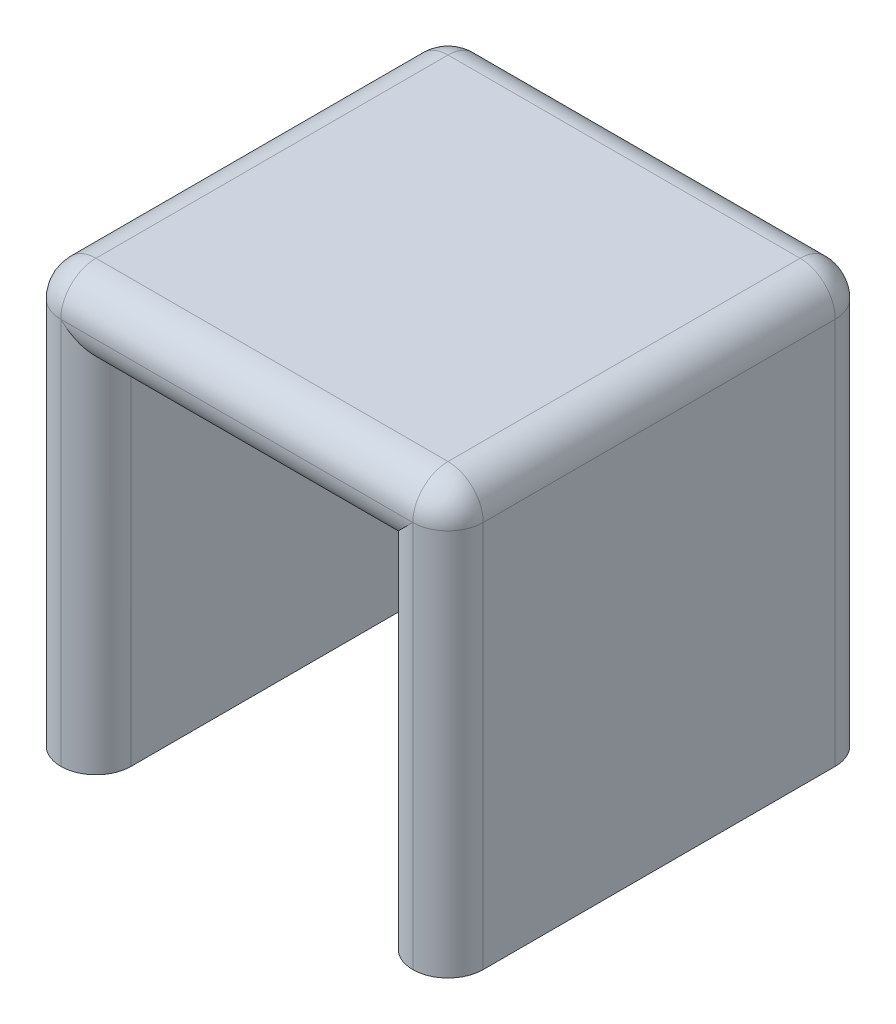
from build123d import *

# Parameters (mm, degrees)
BOSS_EXTRUDE1_DEPTH = 12
FILLET3_R           = 1


with BuildPart() as part:
    # Sketch1 → Boss-Extrude1 (new body)
    with BuildSketch(Plane.XY):
        Polygon((0, 0), (0, 12), (12, 12), (12, 0), (10, 0), (10, 10), (2, 10), (2, 0), align=None)
    extrude(amount=BOSS_EXTRUDE1_DEPTH)

    # Fillet3
    fillet3_edges = [part.edges().sort_by_distance(p)[0] for p in [
        (2, 5, 12),
        (0, 6, 12),
        (12, 6, 12),
        (10, 5, 12),
        (6, 10, 12),
        (6, 12, 12),
        (0, 12, 6),
        (12, 12, 6),
        (12, 6, 0),
        (6, 12, 0),
        (0, 6, 0),
        (10, 5, 0),
        (6, 10, 0),
        (2, 5, 0),
    ]]
    fillet(fillet3_edges, radius=FILLET3_R - 0.0001)  # a hair under: the kernel refuses the full size


solid = part.part
